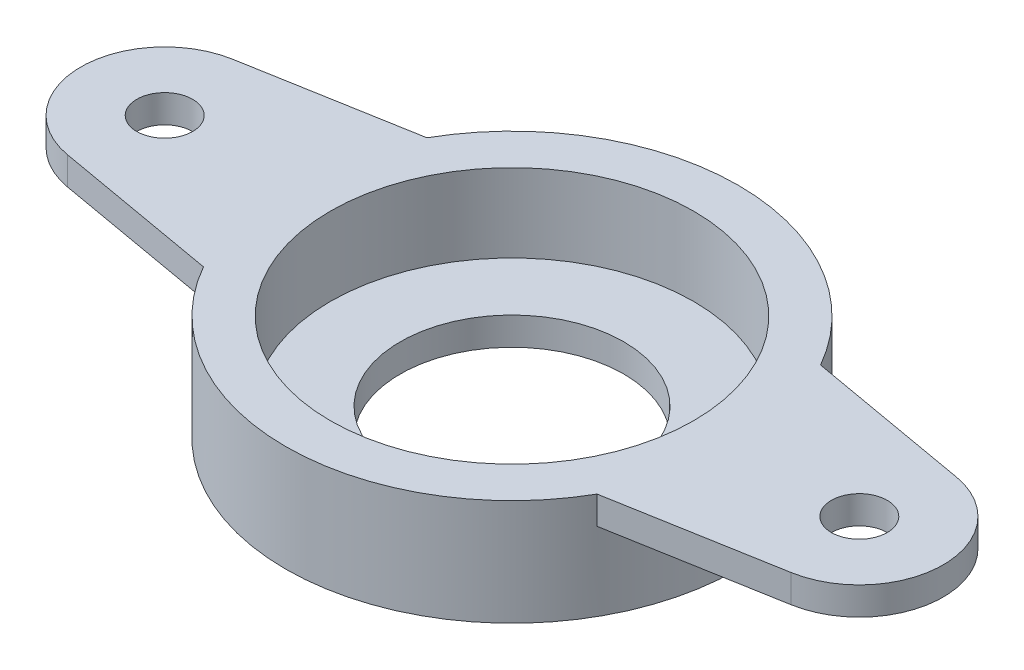
from build123d import *

# Parameters (mm, degrees)
SKETCH1_R           = 25.7175
SKETCH1_R_2         = 20.6375
BOSS_EXTRUDE1_DEPTH = 8.89
BOSS_EXTRUDE2_START = 3.175
SKETCH2_R           = 25.7175
SKETCH2_R_2         = 12.7
BOSS_EXTRUDE2_DEPTH = 3.175
BOSS_EXTRUDE3_START = -3.175
SKETCH3_R           = 3.175
BOSS_EXTRUDE3_DEPTH = 3.175


with BuildPart() as part:
    # Sketch1 → Boss-Extrude1 (new body)
    with BuildSketch(Plane(origin=(0, 0, 0), x_dir=(1, 0, 0), z_dir=(0, 1, 0))):
        Circle(SKETCH1_R)
        Circle(SKETCH1_R_2, mode=Mode.SUBTRACT)
    extrude(amount=BOSS_EXTRUDE1_DEPTH)

    # Sketch2 → Boss-Extrude2 (add)
    with BuildSketch(Plane.XZ.offset(BOSS_EXTRUDE2_START)):
        Circle(SKETCH2_R)
        Circle(SKETCH2_R_2, mode=Mode.SUBTRACT)
    extrude(amount=-BOSS_EXTRUDE2_DEPTH)

    # Sketch3 → Boss-Extrude3 (add)
    # profile 1 of 2: a face of its own
    with BuildSketch(Plane(origin=(0, 8.89, 0), x_dir=(1, 0, 0), z_dir=(0, 1, 0)).offset(BOSS_EXTRUDE3_START)):
        with BuildLine():
            Line((22.362911399, 12.7), (41.123499094, 9.392002215))
            ThreePointArc((41.123499094, 9.392002215), (49.004324689, 0), (41.123499094, -9.392002215))
            Line((41.123499094, -9.392002215), (22.362911399, -12.7))
            ThreePointArc((22.362911399, -12.7), (25.7175, 0), (22.362911399, 12.7))
        make_face()
        with Locations((39.467435701, 0)):
            Circle(SKETCH3_R, mode=Mode.SUBTRACT)
    # profile 2 of 2: a face of its own
    with BuildSketch(Plane(origin=(0, 8.89, 0), x_dir=(1, 0, 0), z_dir=(0, 1, 0)).offset(BOSS_EXTRUDE3_START)):
        with BuildLine():
            Line((-22.362911399, -12.7), (-41.123499094, -9.392002215))
            ThreePointArc((-41.123499094, -9.392002215), (-49.004324689, 0), (-41.123499094, 9.392002215))
            Line((-41.123499094, 9.392002215), (-22.362911399, 12.7))
            ThreePointArc((-22.362911399, 12.7), (-25.7175, 0), (-22.362911399, -12.7))
        make_face()
        with Locations((-39.467435701, 0)):
            Circle(SKETCH3_R, mode=Mode.SUBTRACT)
    extrude(amount=BOSS_EXTRUDE3_DEPTH)


solid = part.part
